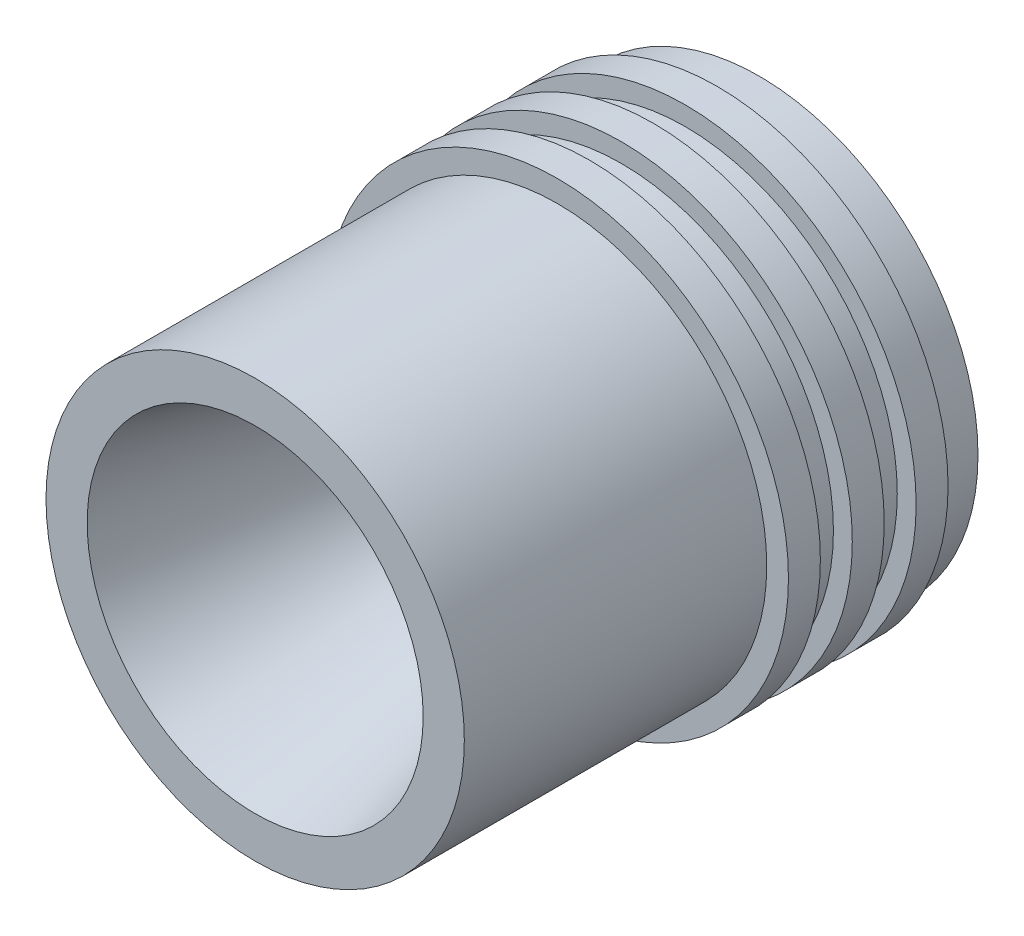
from build123d import *

# Parameters (mm, degrees)
SKETCH2_W = 6.35
SKETCH2_H = 9.652


with BuildPart() as part:
    # Sketch1 → Revolve1 (revolve)
    with BuildSketch(Plane(origin=(0, 0, 0), x_dir=(1, 0, 0), z_dir=(0, 1, 0))):
        Polygon((69.8119, 139.7), (69.8119, 91.44), (63.246, 91.44), (63.246, 0), (50.80377239, 0), (18.415, 120.876544155), (18.415, 128.496544155), (59.817, 152.4), (66.167, 152.4), (66.167, 139.7), align=None)
    revolve(axis=Axis((0, 0, 8.145225657), (0, 0, -1)))

    # Sketch2 → Cut-Revolve1 (revolve, cut)
    with BuildSketch(Plane(origin=(0, 0, 0), x_dir=(1, 0, 0), z_dir=(0, 1, 0))):
        with Locations((67.2846, 125.222)):
            Rectangle(SKETCH2_W, SKETCH2_H)
        with Locations((67.2846, 105.918)):
            Rectangle(SKETCH2_W, SKETCH2_H)
    revolve(axis=Axis((0, 0, 8.145225657), (0, 0, -1)), mode=Mode.SUBTRACT)

    # Sketch3 → Cut-Revolve2 (revolve, cut)
    with BuildSketch(Plane(origin=(0, 0, 0), x_dir=(1, 0, 0), z_dir=(0, 1, 0))):
        Polygon((44.45, 143.527858413), (44.45, 130.827858413), (39.115128663, 69.85), (32.087521299, 69.85), (18.415, 120.876544155), (18.415, 128.496544155), align=None)
    revolve(axis=Axis((0, 0, 8.145225657), (0, 0, -1)), mode=Mode.SUBTRACT)


solid = part.part
